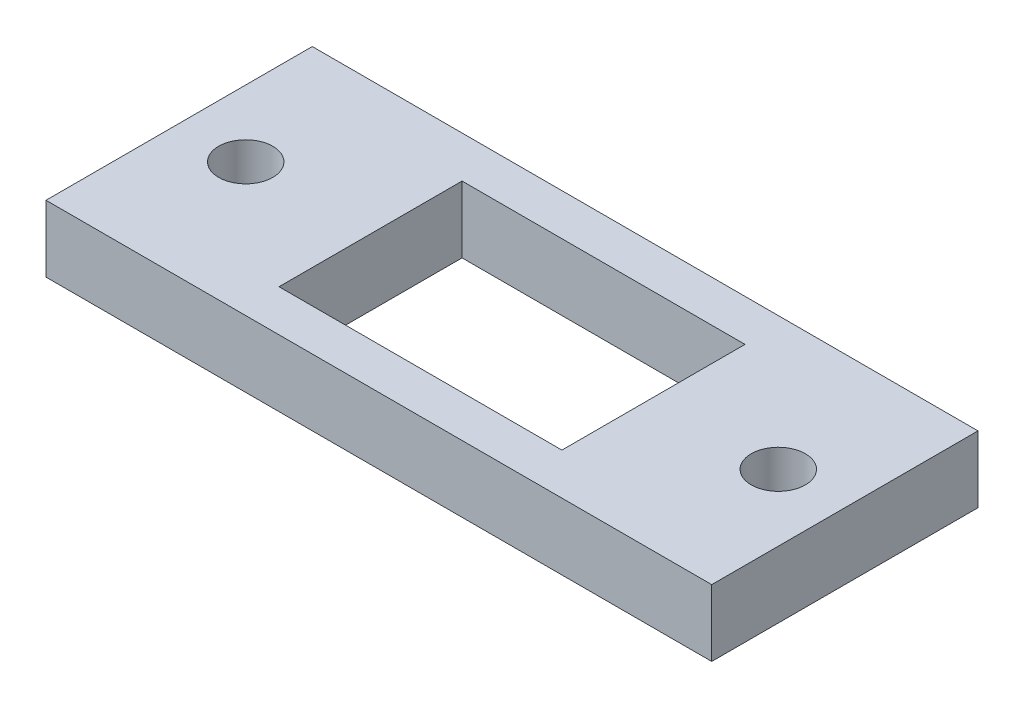
from build123d import *

# Parameters (mm, degrees)
SKETCH1_W           = 254
SKETCH1_H           = 101.6
SKETCH1_R           = 10.31875
SKETCH1_W_2         = 107.95
SKETCH1_H_2         = 69.85
BOSS_EXTRUDE1_DEPTH = 25.4


with BuildPart() as part:
    # Sketch1 → Boss-Extrude1 (new body)
    with BuildSketch(Plane(origin=(0, 0, 0), x_dir=(1, 0, 0), z_dir=(0, 1, 0))):
        with Locations((127, 50.8)):
            Rectangle(SKETCH1_W, SKETCH1_H)
        with Locations((25.4, 50.8)):
            Circle(SKETCH1_R, mode=Mode.SUBTRACT)
        with Locations((228.6, 50.8)):
            Circle(SKETCH1_R, mode=Mode.SUBTRACT)
        with Locations((127, 50.8)):
            Rectangle(SKETCH1_W_2, SKETCH1_H_2, mode=Mode.SUBTRACT)
    extrude(amount=BOSS_EXTRUDE1_DEPTH)


solid = part.part
